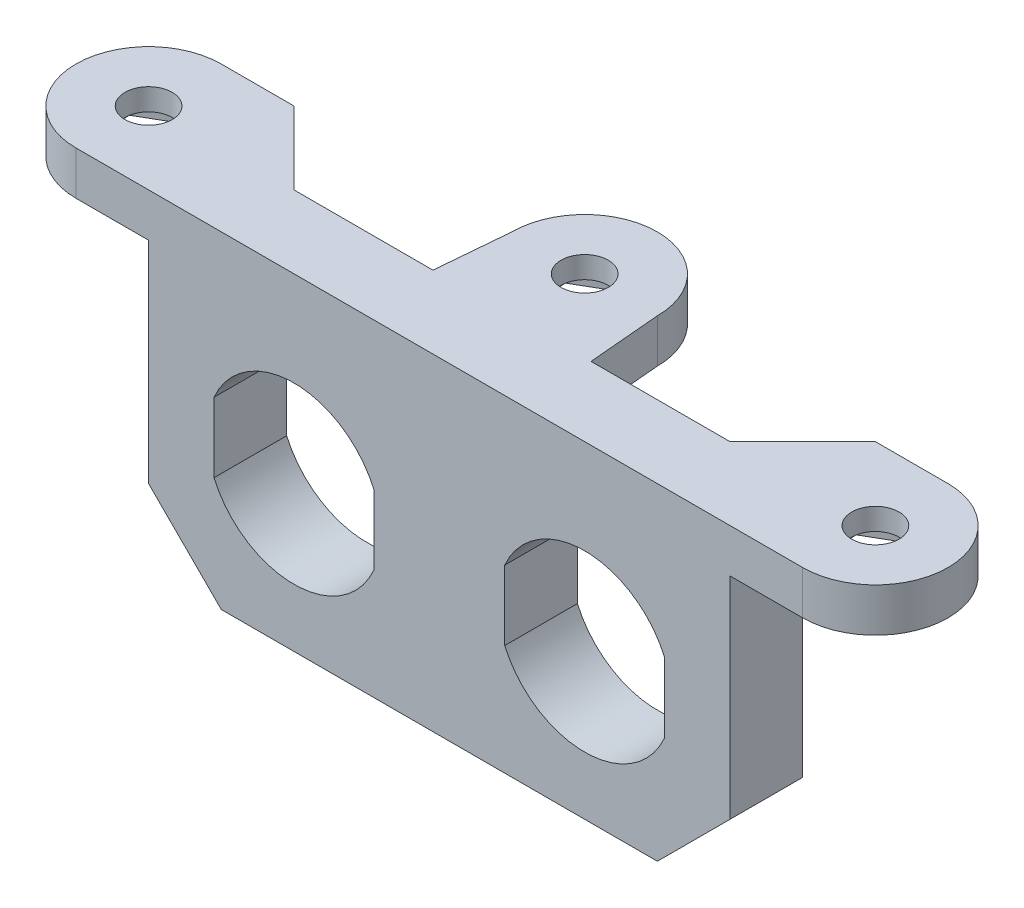
from build123d import *
from OCP.BRepFilletAPI import BRepFilletAPI_MakeChamfer

# Parameters (mm, degrees)
SKETCH1_R           = 1.625
BOSS_EXTRUDE1_DEPTH = 22.5
SKETCH5_W           = 15
SKETCH5_H           = 5
CUT_EXTRUDE1_DEPTH  = 41.388736054
CUT_EXTRUDE2_DEPTH  = 19.5
CUT_EXTRUDE3_DEPTH  = 39.810436741
CHAMFER1_SIZE       = 5
CHAMFER2_SIZE       = 0.437443318
CHAMFER2_SIZE_2     = 5
CHAMFER3_SIZE       = 5
CUT_EXTRUDE4_DEPTH  = 1.5


with BuildPart() as part:
    # Sketch1 → Boss-Extrude1 (new body)
    with BuildSketch(Plane(origin=(0, 0, 0), x_dir=(1, 0, 0), z_dir=(0, 1, 0))):
        with BuildLine():
            Line((-25, 10), (-5, 10))
            ThreePointArc((-5, 10), (0, 15), (5, 10))
            Line((5, 10), (25, 10))
            ThreePointArc((25, 10), (30, 5), (25, 0))
            Line((25, 0), (-25, 0))
            ThreePointArc((-25, 0), (-30, 5), (-25, 10))
        make_face()
        with Locations(Location((-25, 5, 0), (0, 0, 90))):
            Circle(SKETCH1_R, mode=Mode.SUBTRACT)
        with Locations(Location((25, 5, 0), (0, 0, 90))):
            Circle(SKETCH1_R, mode=Mode.SUBTRACT)
        with Locations(Location((0, 10, 0), (0, 0, 90))):
            Circle(SKETCH1_R, mode=Mode.SUBTRACT)
    extrude(amount=BOSS_EXTRUDE1_DEPTH)

    # Sketch5 → Cut-Extrude1 (cut, through all)
    with BuildSketch(Plane(origin=(0, 0, 0), x_dir=(1, 0, 0), z_dir=(0, 1, 0))):
        with Locations((-12.5, 7.5)):
            Rectangle(SKETCH5_W, SKETCH5_H)
        with Locations((12.5, 7.5)):
            Rectangle(SKETCH5_W, SKETCH5_H)
    extrude(amount=CUT_EXTRUDE1_DEPTH, mode=Mode.SUBTRACT)

    # Sketch6 → Cut-Extrude2 (cut)
    with BuildSketch(Plane.XZ):
        with BuildLine():
            Line((-25, 0), (-20, 0))
            Line((-20, 0), (-20, -10))
            Line((-20, -10), (-25, -10))
            ThreePointArc((-25, -10), (-30, -5), (-25, 0))
        make_face()
        with BuildLine():
            Line((20, 0), (20, -10))
            Line((20, -10), (25, -10))
            ThreePointArc((25, -10), (30, -5), (25, 0))
            Line((25, 0), (20, 0))
        make_face()
        with BuildLine():
            Line((-5, -5), (5, -5))
            Line((5, -5), (5, -10))
            ThreePointArc((5, -10), (0, -15), (-5, -10))
            Line((-5, -10), (-5, -5))
        make_face()
    extrude(amount=-CUT_EXTRUDE2_DEPTH, mode=Mode.SUBTRACT)

    # Sketch7 → Cut-Extrude3 (cut, through all)
    with BuildSketch(Plane(origin=(0, 0, -5), x_dir=(-1, 0, 0), z_dir=(0, 0, -1))):
        with BuildLine():
            Line((4.5, 12.397915762), (4.5, 7.602084238))
            ThreePointArc((4.5, 7.602084238), (10, 4), (15.5, 7.602084238))
            Line((15.5, 7.602084238), (15.5, 12.397915762))
            ThreePointArc((15.5, 12.397915762), (10, 16), (4.5, 12.397915762))
        make_face()
        with BuildLine():
            Line((-15.5, 12.397915762), (-15.5, 7.602084238))
            ThreePointArc((-15.5, 7.602084238), (-10, 4), (-4.5, 7.602084238))
            Line((-4.5, 7.602084238), (-4.5, 12.397915762))
            ThreePointArc((-4.5, 12.397915762), (-10, 16), (-15.5, 12.397915762))
        make_face()
    extrude(amount=-CUT_EXTRUDE3_DEPTH, mode=Mode.SUBTRACT)

    # Chamfer1
    chamfer1_edges = [part.edges().sort_by_distance(p)[0] for p in [
        (-20, 21, -5),
        (20, 21, -5),
    ]]
    chamfer(chamfer1_edges, length=CHAMFER1_SIZE - 0.0001)  # a hair under: the kernel refuses the full size

    # Chamfer2
    chamfer2_edges_1 = [part.edges().sort_by_distance(p)[0] for p in [
        (-5, 21, -5),
    ]]
    chamfer2_side_1 = [part.faces().sort_by_distance(p)[0] for p in [
        (-5.008748866, 21, -5),
    ]]
    chamfer2_edges_2 = [part.edges().sort_by_distance(p)[0] for p in [
        (5, 21, -5),
    ]]
    chamfer2_side_2 = [part.faces().sort_by_distance(p)[0] for p in [
        (5.008748866, 21, -5),
    ]]
    chamfer2 = BRepFilletAPI_MakeChamfer(part.part.solid().wrapped)
    for e in chamfer2_edges_1:
        chamfer2.Add(CHAMFER2_SIZE - 0.0001, CHAMFER2_SIZE_2 - 0.0001, e.wrapped, chamfer2_side_1[0].wrapped)
    for e in chamfer2_edges_2:
        chamfer2.Add(CHAMFER2_SIZE - 0.0001, CHAMFER2_SIZE_2 - 0.0001, e.wrapped, chamfer2_side_2[0].wrapped)
    add(Compound.cast(chamfer2.Shape()), mode=Mode.REPLACE)  # a hair under: the kernel refuses the full size

    # Chamfer3
    chamfer3_edges = [part.edges().sort_by_distance(p)[0] for p in [
        (-20, 0, -2.5),
        (20, 0, -2.5),
    ]]
    chamfer(chamfer3_edges, length=CHAMFER3_SIZE)

    # Sketch8 → Cut-Extrude4 (cut)
    with BuildSketch(Plane.XZ.offset(-19.5)):
        Polygon((25, -8.579571669), (28.1, -6.789785834), (28.1, -3.210214166), (25, -1.420428331), (21.9, -3.210214166), (21.9, -6.789785834), align=None)
        Polygon((0, -13.579571669), (3.1, -11.789785834), (3.1, -8.210214166), (0, -6.420428331), (-3.1, -8.210214166), (-3.1, -11.789785834), align=None)
        Polygon((-25, -8.579571669), (-21.9, -6.789785834), (-21.9, -3.210214166), (-25, -1.420428331), (-28.1, -3.210214166), (-28.1, -6.789785834), align=None)
    extrude(amount=-CUT_EXTRUDE4_DEPTH, mode=Mode.SUBTRACT)


solid = part.part
